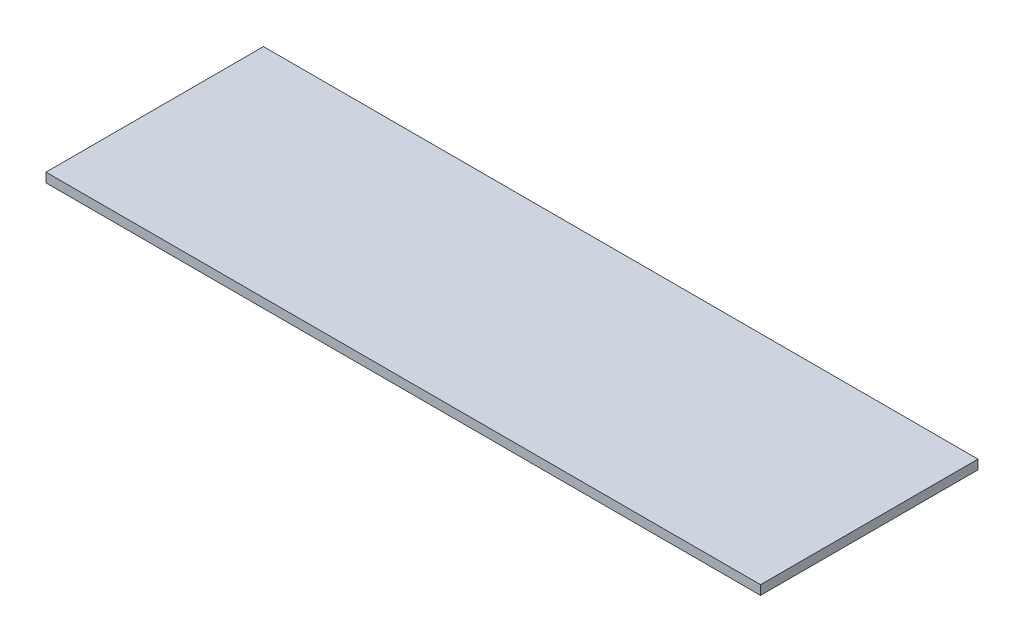
from build123d import *

# Parameters (mm, degrees)
SKETCH1_W           = 230
SKETCH1_H           = 70
BOSS_EXTRUDE1_DEPTH = 3


with BuildPart() as part:
    # Sketch1 → Boss-Extrude1 (new body)
    with BuildSketch(Plane(origin=(0, 0, 0), x_dir=(1, 0, 0), z_dir=(0, 1, 0))):
        Rectangle(SKETCH1_W, SKETCH1_H)
    extrude(amount=BOSS_EXTRUDE1_DEPTH)


solid = part.part
